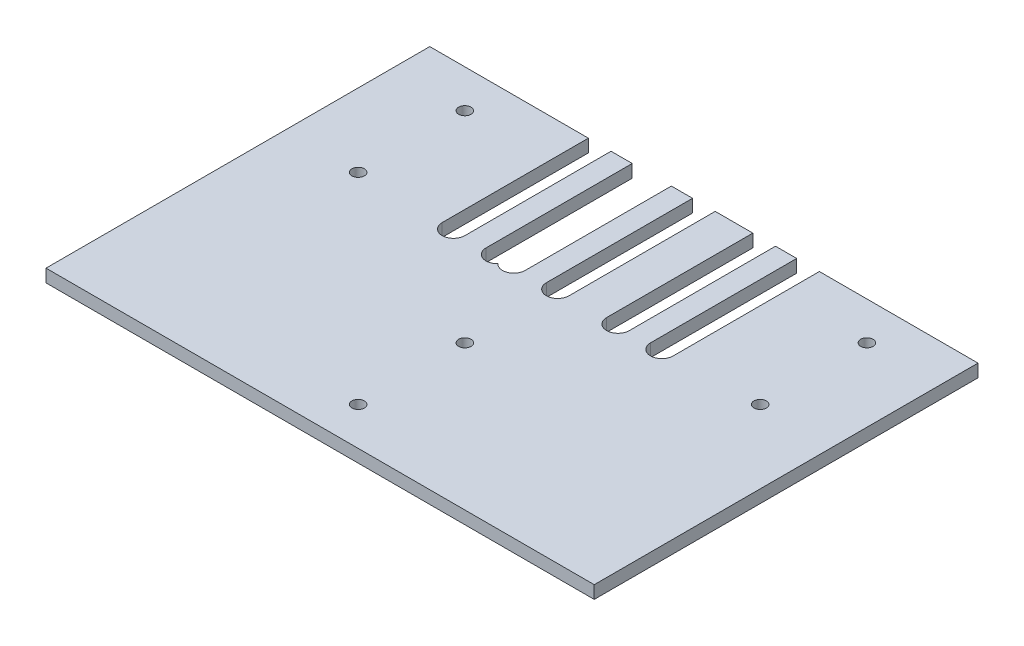
from build123d import *

# Parameters (mm, degrees)
SKETCH1_W                  = 150
SKETCH1_H                  = 105
BOSS_EXTRUDE1_DEPTH        = 3.5
CUT_EXTRUDE1_DEPTH         = 184.131783151
CUT_EXTRUDE2_DEPTH         = 184.131783151
F_3_4_3_4_DIAMETER_HOLE1_D = 3.4


with BuildPart() as part:
    # Sketch1 → Boss-Extrude1 (new body)
    with BuildSketch(Plane(origin=(0, 0, 0), x_dir=(1, 0, 0), z_dir=(0, 1, 0))):
        with Locations((75, 52.5)):
            Rectangle(SKETCH1_W, SKETCH1_H)
    extrude(amount=BOSS_EXTRUDE1_DEPTH)

    # Sketch3 → Cut-Extrude1 (cut, through all)
    with BuildSketch(Plane(origin=(0, 3.5, 0), x_dir=(1, 0, 0), z_dir=(0, 1, 0))):
        with BuildLine():
            Line((94.6, 105), (94.6, 65))
            ThreePointArc((94.6, 65), (91.5, 61.9), (88.4, 65))
            Line((88.4, 65), (88.4, 105))
            Line((88.4, 105), (94.6, 105))
        make_face()
        with BuildLine():
            Line((78.1, 105), (78.1, 65))
            ThreePointArc((78.1, 65), (75, 61.9), (71.9, 65))
            Line((71.9, 65), (71.9, 105))
            Line((71.9, 105), (78.1, 105))
        make_face()
        with BuildLine():
            Line((106.6, 105), (106.6, 65))
            ThreePointArc((106.6, 65), (103.5, 61.9), (100.4, 65))
            Line((100.4, 65), (100.4, 105))
            Line((100.4, 105), (106.6, 105))
        make_face()
        with BuildLine():
            Line((66.1, 105), (66.1, 65))
            ThreePointArc((66.1, 65), (63, 61.9), (59.9, 65))
            Line((59.9, 65), (59.9, 105))
            Line((59.9, 105), (66.1, 105))
        make_face()
        with BuildLine():
            Line((49.6, 105), (49.6, 65))
            ThreePointArc((49.6, 65), (46.5, 61.9), (43.4, 65))
            Line((43.4, 65), (43.4, 105))
            Line((43.4, 105), (49.6, 105))
        make_face()
    extrude(amount=-CUT_EXTRUDE1_DEPTH, mode=Mode.SUBTRACT)

    # Sketch4 → Cut-Extrude2 (cut, through all)
    with BuildSketch(Plane(origin=(0, 3.5, 0), x_dir=(1, 0, 0), z_dir=(0, 1, 0))):
        with BuildLine():
            Line((55.4, 105), (61.6, 105))
            Line((61.6, 105), (61.6, 65))
            ThreePointArc((61.6, 65), (58.5, 61.9), (55.4, 65))
            Line((55.4, 65), (55.4, 105))
        make_face()
    extrude(amount=-CUT_EXTRUDE2_DEPTH, mode=Mode.SUBTRACT)

    # Ø3.4 (3.4) Diameter Hole1 (through all)
    with Locations(Plane(origin=(0, 3.5, 0), x_dir=(1, 0, 0), z_dir=(0, 1, 0))):
        with Locations((20, 94.6), (20, 65.4), (130, 65.4), (130, 94.6), (75, 39.6), (75, 10.4)):
            Hole(F_3_4_3_4_DIAMETER_HOLE1_D / 2)


solid = part.part
